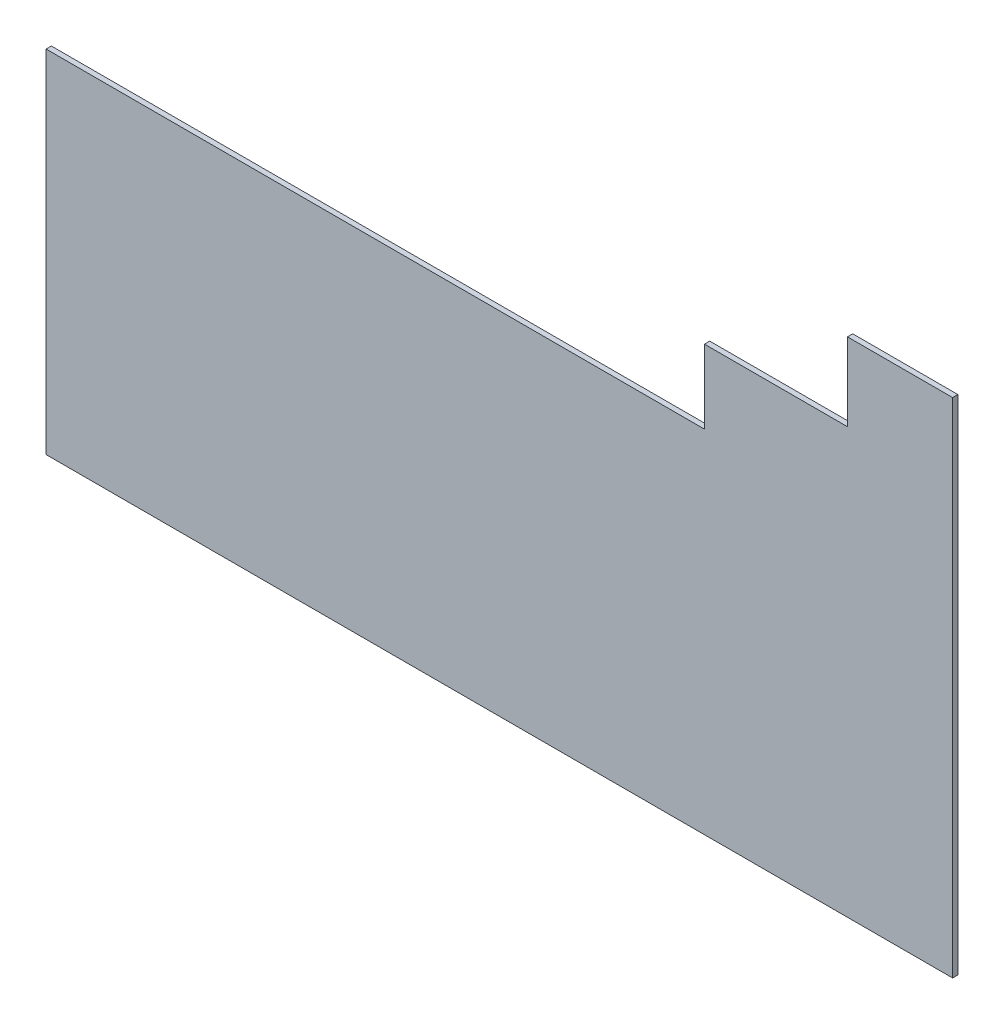
from build123d import *

# Parameters (mm, degrees)
TABAN_FLAN_1_DEPTH         = 25
KES_EKSTR_ZYON1_DEPTH      = 6508.676543898
KES_EKSTR_ZYON1_DEPTH_BACK = 6508.676543898
IZIM7_W                    = 1400
IZIM7_H                    = 1895
IZIM7_W_2                  = 310
IZIM7_H_2                  = 495
KES_EKSTR_ZYON2_DEPTH      = 6508.676543898
KES_EKSTR_ZYON2_DEPTH_BACK = 6508.676543898
IZIM8_W                    = 292
IZIM8_H                    = 2515
KES_EKSTR_ZYON3_DEPTH      = 6240.38698912
KES_EKSTR_ZYON3_DEPTH_BACK = 6240.38698912
IZIM10_W                   = 2900
IZIM10_H                   = 350
KES_EKSTR_ZYON4_DEPTH      = 6240.38698912
KES_EKSTR_ZYON4_DEPTH_BACK = 6240.38698912


# Sheet-metal steps are written as plain solids
with BuildPart() as part:
    # Çizim1 → Taban-Flanş1 (new body)
    with BuildSketch(Plane.XY):
        Polygon((0, 0), (0, 1895), (2935, 1895), (2935, 2020), (4900, 2020), (4900, 2515), (6002, 2515), (6002, 0), align=None)
    extrude(amount=-TABAN_FLAN_1_DEPTH)

    # Çizim7 → Kes-Ekstrüzyon1 (cut, two sides: drawn at the far end of the back side and taken through both)
    with BuildSketch(Plane.XY.offset(-KES_EKSTR_ZYON1_DEPTH_BACK)):
        with Locations((700, 947.5)):
            Rectangle(IZIM7_W, IZIM7_H)
        with Locations((5055, 2267.5)):
            Rectangle(IZIM7_W_2, IZIM7_H_2)
    extrude(amount=KES_EKSTR_ZYON1_DEPTH + KES_EKSTR_ZYON1_DEPTH_BACK, mode=Mode.SUBTRACT)

    # Çizim8 → Kes-Ekstrüzyon2 (cut, two sides: drawn at the far end of the back side and taken through both)
    with BuildSketch(Plane.XY.offset(-KES_EKSTR_ZYON2_DEPTH_BACK)):
        with Locations((5856, 1257.5)):
            Rectangle(IZIM8_W, IZIM8_H)
    extrude(amount=KES_EKSTR_ZYON2_DEPTH + KES_EKSTR_ZYON2_DEPTH_BACK, mode=Mode.SUBTRACT)

    # Çizim10 → Kes-Ekstrüzyon3 (cut, two sides: drawn at the far end of the back side and taken through both)
    with BuildSketch(Plane.XY.offset(-KES_EKSTR_ZYON3_DEPTH_BACK)):
        with Locations((2850, 1845)):
            Rectangle(IZIM10_W, IZIM10_H)
    extrude(amount=KES_EKSTR_ZYON3_DEPTH + KES_EKSTR_ZYON3_DEPTH_BACK, mode=Mode.SUBTRACT)

    # Çizim11 → Kes-Ekstrüzyon4 (cut, two sides: drawn at the far end of the back side and taken through both)
    with BuildSketch(Plane.XY.offset(-KES_EKSTR_ZYON4_DEPTH_BACK)):
        Polygon((4300, 1670), (4530, 1670), (4530, 2020), (5210, 2020), (5210, 2390), (5710, 2390), (5778.630385148, 2406.496682207), (5749.815338653, 2697.266696836), (5189.231706845, 2697.266696836), (4530, 2199.552257381), (4300, 2199.552257381), align=None)
    extrude(amount=KES_EKSTR_ZYON4_DEPTH + KES_EKSTR_ZYON4_DEPTH_BACK, mode=Mode.SUBTRACT)


solid = part.part
